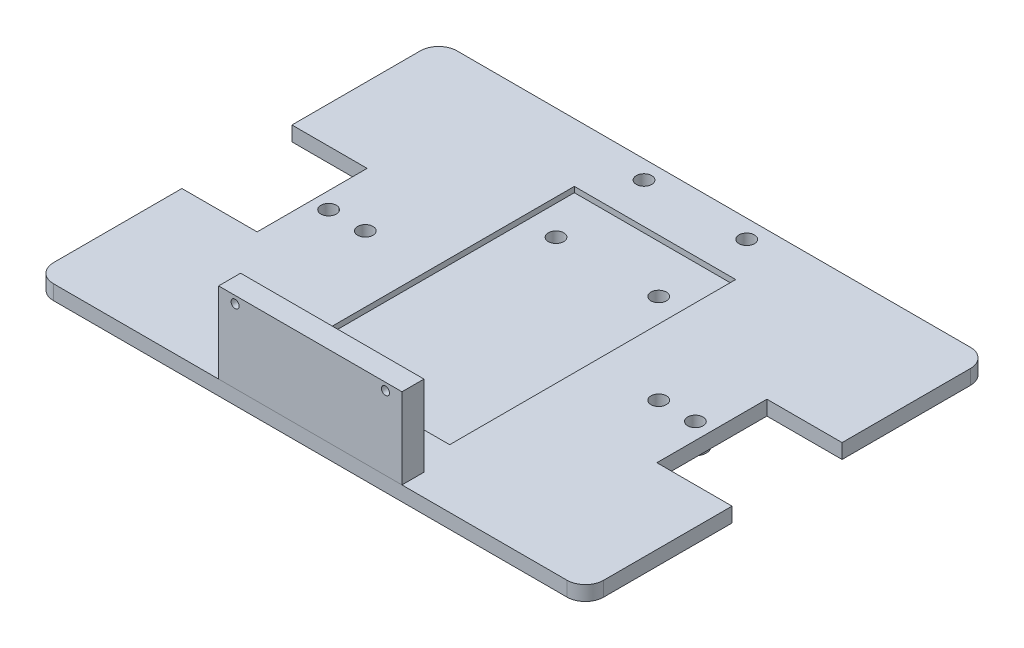
from build123d import *

# Parameters (mm, degrees)
SKETCH1_W           = 150
SKETCH1_H           = 110
BOSS_EXTRUDE1_DEPTH = 4
FILLET1_R           = 5
SKETCH2_R           = 2.1
CUT_EXTRUDE1_DEPTH  = 94.091352982
SKETCH3_R           = 3
BOSS_EXTRUDE2_DEPTH = 2
CUT_EXTRUDE2_DEPTH  = 1.5
SKETCH7_W           = 50
SKETCH7_H           = 22
BOSS_EXTRUDE4_DEPTH = 6
SKETCH8_R           = 1.1
CUT_EXTRUDE3_DEPTH  = 131.831953284
SKETCH10_R          = 2.1
CUT_EXTRUDE5_DEPTH  = 96.571962416
SKETCH11_W          = 20.5
SKETCH11_H          = 30
CUT_EXTRUDE6_DEPTH  = 96.571962416
SKETCH12_R          = 4
BOSS_EXTRUDE5_DEPTH = 3.5
SKETCH13_R          = 2.1
CUT_EXTRUDE7_DEPTH  = 96.571962416


with BuildPart() as part:
    # Sketch1 → Boss-Extrude1 (new body)
    with BuildSketch(Plane(origin=(0, 0, 0), x_dir=(1, 0, 0), z_dir=(0, 1, 0))):
        Rectangle(SKETCH1_W, SKETCH1_H)
    extrude(amount=BOSS_EXTRUDE1_DEPTH)

    # Fillet1
    fillet1_edges = [part.edges().sort_by_distance(p)[0] for p in [
        (-75, 2, -55),
        (-75, 2, 55),
        (75, 2, -55),
        (75, 2, 55),
    ]]
    fillet(fillet1_edges, radius=FILLET1_R)

    # Sketch2 → Cut-Extrude1 (cut, through all)
    with BuildSketch(Plane(origin=(0, 4, 0), x_dir=(1, 0, 0), z_dir=(0, 1, 0))):
        with Locations((-50, 0)):
            Circle(SKETCH2_R)
        with Locations((-40, 0)):
            Circle(SKETCH2_R)
    cut_extrude1 = extrude(amount=-CUT_EXTRUDE1_DEPTH, mode=Mode.SUBTRACT)

    # Sketch3 → Boss-Extrude2 (add)
    with BuildSketch(Plane.XZ):
        with Locations((-50, 0)):
            Circle(SKETCH3_R)
        with Locations((-40, 0)):
            Circle(SKETCH3_R)
    boss_extrude2 = extrude(amount=BOSS_EXTRUDE2_DEPTH)

    # Mirror1: Cut-Extrude1, Boss-Extrude2 across plane
    add(cut_extrude1.mirror(Plane(origin=(0, 0, 0), x_dir=(0, 0, 1), z_dir=(1, 0, 0))), mode=Mode.SUBTRACT)
    add(boss_extrude2.mirror(Plane(origin=(0, 0, 0), x_dir=(0, 0, 1), z_dir=(1, 0, 0))))

    # Sketch4 → Cut-Extrude2 (cut)
    with BuildSketch(Plane(origin=(0, 4, 0), x_dir=(1, 0, 0), z_dir=(0, 1, 0))):
        Polygon((-22, -39), (-6, -39), (-6, -43), (6, -43), (6, -39), (22, -39), (22, 39), (-22, 39), align=None)
    extrude(amount=-CUT_EXTRUDE2_DEPTH, mode=Mode.SUBTRACT)

    # Sketch10 → Cut-Extrude5 (cut, through all)
    with BuildSketch(Plane(origin=(0, 4, 0), x_dir=(1, 0, 0), z_dir=(0, 1, 0))):
        with Locations((-50, 0)):
            Circle(SKETCH10_R)
        with Locations((-40, 0)):
            Circle(SKETCH10_R)
        with Locations((40, 0)):
            Circle(SKETCH10_R)
        with Locations((50, 0)):
            Circle(SKETCH10_R)
    extrude(amount=-CUT_EXTRUDE5_DEPTH, mode=Mode.SUBTRACT)

    # Sketch11 → Cut-Extrude6 (cut, through all)
    with BuildSketch(Plane(origin=(0, 4, 0), x_dir=(1, 0, 0), z_dir=(0, 1, 0))):
        with Locations((64.75, 0)):
            Rectangle(SKETCH11_W, SKETCH11_H)
        with Locations((-64.75, 0)):
            Rectangle(SKETCH11_W, SKETCH11_H)
    extrude(amount=-CUT_EXTRUDE6_DEPTH, mode=Mode.SUBTRACT)

    # Sketch12 → Boss-Extrude5 (add)
    with BuildSketch(Plane.XZ):
        with Locations((-14, -26)):
            Circle(SKETCH12_R)
        with Locations((14, -26)):
            Circle(SKETCH12_R)
        with Locations((14, -50)):
            Circle(SKETCH12_R)
        with Locations((-14, -50)):
            Circle(SKETCH12_R)
    extrude(amount=BOSS_EXTRUDE5_DEPTH)

    # Sketch13 → Cut-Extrude7 (cut, through all)
    with BuildSketch(Plane(origin=(0, 4, 0), x_dir=(1, 0, 0), z_dir=(0, 1, 0))):
        with Locations((14, 26)):
            Circle(SKETCH13_R)
        with Locations((-14, 50)):
            Circle(SKETCH13_R)
        with Locations((14, 50)):
            Circle(SKETCH13_R)
        with Locations((-14, 26)):
            Circle(SKETCH13_R)
    extrude(amount=-CUT_EXTRUDE7_DEPTH, mode=Mode.SUBTRACT)


with BuildPart() as body_2:
    # Sketch7 → Boss-Extrude4 (new body)
    with BuildSketch(Plane.XY.offset(55)):
        with Locations((0, 15)):
            Rectangle(SKETCH7_W, SKETCH7_H)
    extrude(amount=-BOSS_EXTRUDE4_DEPTH)

    # Sketch8 → Cut-Extrude3 (cut, through all)
    with BuildSketch(Plane(origin=(0, 0, 49), x_dir=(-1, 0, 0), z_dir=(0, 0, -1))):
        with Locations((-20.5, 24)):
            Circle(SKETCH8_R)
        with Locations((20.5, 24)):
            Circle(SKETCH8_R)
    extrude(amount=-CUT_EXTRUDE3_DEPTH, mode=Mode.SUBTRACT)


solid = Compound([part.part, body_2.part])
